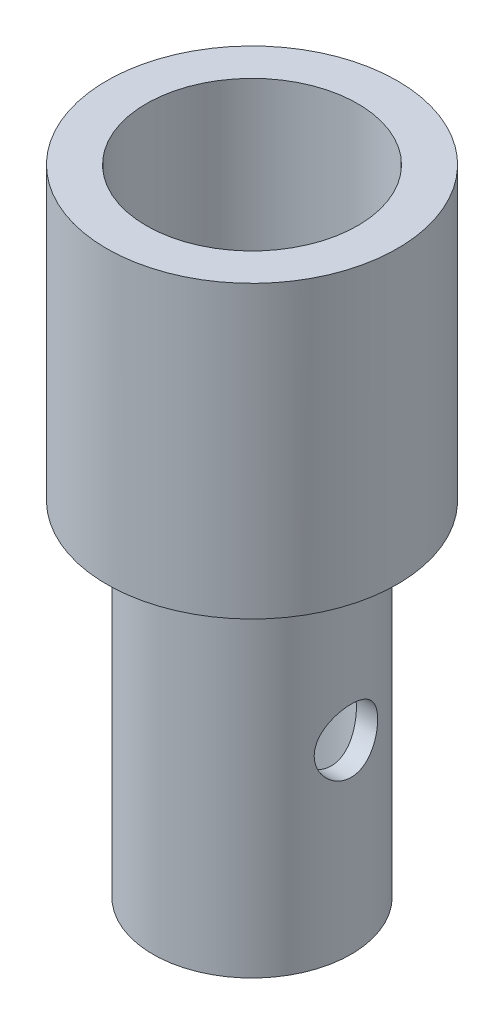
from build123d import *

# Parameters (mm, degrees)
SKETCH1_R            = 17.4625
SKETCH1_R_2          = 12.7
SPRING_CHAMBER_DEPTH = 28.575
BALL_CHAMBER_START   = 47.625
SKETCH2_R            = 17.4625
SKETCH2_R_2          = 9.525
BALL_CHAMBER_DEPTH   = 47.625
SKETCH5_R            = 3.81
BALL_HOLE_DEPTH      = 54.647166165
SKETCH8_R            = 17.4625
SKETCH8_R_2          = 11.90625
CUT_EXTRUDE2_DEPTH   = 41.275
SKETCH6_R            = 17.4625
SKETCH6_R_2          = 1.651
BOSS_EXTRUDE4_DEPTH  = 6.35


with BuildPart() as part:
    # Sketch1 → spring_chamber (new body)
    with BuildSketch(Plane(origin=(0, 0, 0), x_dir=(1, 0, 0), z_dir=(0, 1, 0))):
        with Locations(Location((0, 0, 0), (0, 0, 270))):
            Circle(SKETCH1_R)
        with Locations(Location((0, 0, 0), (0, 0, 270))):
            Circle(SKETCH1_R_2, mode=Mode.SUBTRACT)
    extrude(amount=SPRING_CHAMBER_DEPTH)

    # Sketch2 → ball_chamber (add)
    with BuildSketch(Plane.XZ.offset(BALL_CHAMBER_START)):
        with Locations(Location((0, 0, 0), (0, 0, 270))):
            Circle(SKETCH2_R)
        with Locations(Location((0, 0, 0), (0, 0, 270))):
            Circle(SKETCH2_R_2, mode=Mode.SUBTRACT)
    extrude(amount=-BALL_CHAMBER_DEPTH)

    # Sketch5 → ball_hole (cut, through all)
    with BuildSketch(Plane(origin=(0, 0, 0), x_dir=(0, 0, -1), z_dir=(1, 0, 0))):
        with Locations(Location((0, -25.4, 0), (0, 0, 180))):
            Circle(SKETCH5_R)
    ball_hole = extrude(amount=BALL_HOLE_DEPTH, mode=Mode.SUBTRACT)

    # Sketch8 → Cut-Extrude2 (cut)
    with BuildSketch(Plane.XZ.offset(47.625)):
        with Locations(Location((0, 0, 0), (0, 0, 270))):
            Circle(SKETCH8_R)
        with Locations(Location((0, 0, 0), (0, 0, 270))):
            Circle(SKETCH8_R_2, mode=Mode.SUBTRACT)
    extrude(amount=-CUT_EXTRUDE2_DEPTH, mode=Mode.SUBTRACT)

    # Mirror1: ball_hole across plane
    add(ball_hole.mirror(Plane(origin=(0, 0, 0), x_dir=(0, 0, 1), z_dir=(1, 0, 0))), mode=Mode.SUBTRACT)

    # Sketch6 → Boss-Extrude4 (add)
    with BuildSketch(Plane(origin=(0, 28.575, 0), x_dir=(1, 0, 0), z_dir=(0, 1, 0))):
        with BuildLine():
            ThreePointArc((-28.810185185, 6.345643224), (-34.925, 0), (-28.810185185, -6.345643224))
            ThreePointArc((-28.810185185, -6.345643224), (-23.017865483, -7.988458599), (-18.633080808, -12.114409792))
            ThreePointArc((-18.633080808, -12.114409792), (0, -22.225), (18.633080808, -12.114409792))
            ThreePointArc((18.633080808, -12.114409792), (23.017865483, -7.988458599), (28.810185185, -6.345643224))
            ThreePointArc((28.810185185, -6.345643224), (34.925, 0), (28.810185185, 6.345643224))
            ThreePointArc((28.810185185, 6.345643224), (23.017865483, 7.988458599), (18.633080808, 12.114409792))
            ThreePointArc((18.633080808, 12.114409792), (0, 22.225), (-18.633080808, 12.114409792))
            ThreePointArc((-18.633080808, 12.114409792), (-23.017865483, 7.988458599), (-28.810185185, 6.345643224))
        make_face()
        with Locations(Location((0, 0, 0), (0, 0, 90))):
            Circle(SKETCH6_R, mode=Mode.SUBTRACT)
        with Locations((-28.575, 0)):
            Circle(SKETCH6_R_2, mode=Mode.SUBTRACT)
        with Locations((28.575, 0)):
            Circle(SKETCH6_R_2, mode=Mode.SUBTRACT)
    extrude(amount=BOSS_EXTRUDE4_DEPTH)


with BuildPart() as boss_extrude4_kept_piece:
    # of the separate pieces the step leaves, the one the design keeps (boss_extrude4_pieces_kept)
    add(part.part.solids().sort_by_distance((0, 0, 17.4625))[0])


solid = boss_extrude4_kept_piece.part
